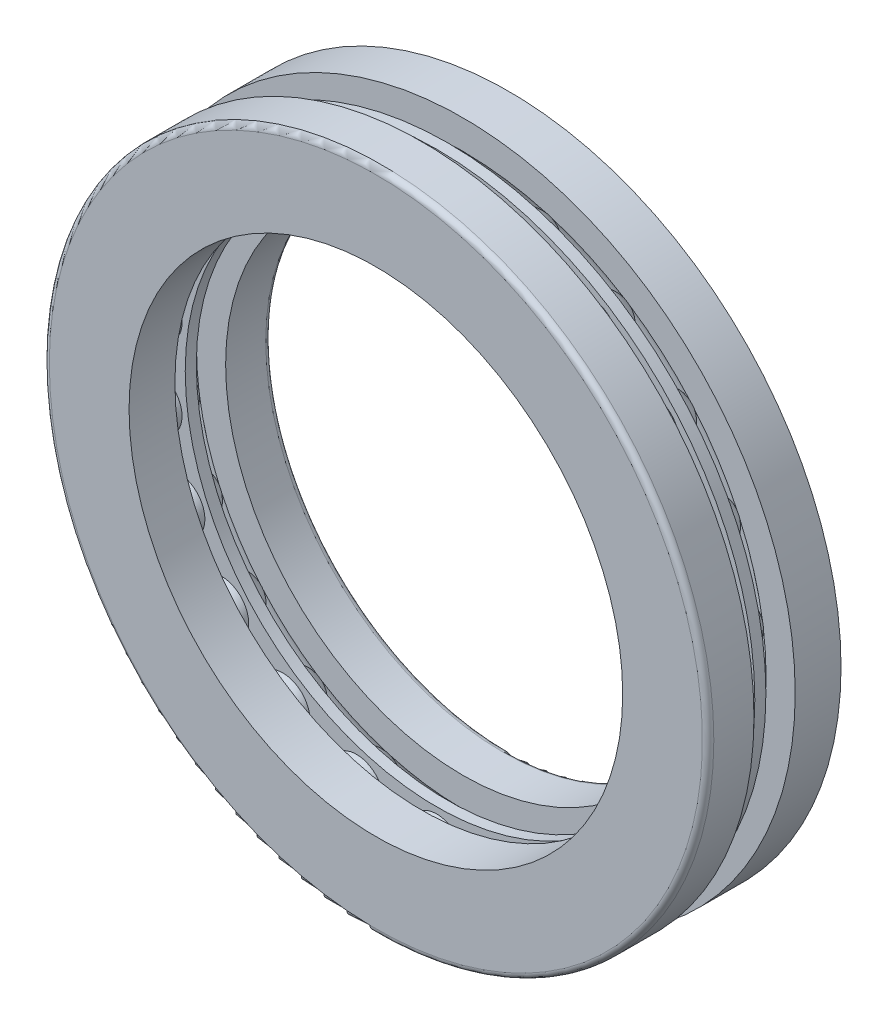
from build123d import *
from build123d.topology import SkipClean

# Parameters (mm, degrees)
FILLET1_R            = 0.6
CIRPATTERNBALL_COUNT = 22
CAGESKE_W            = 1.166666666
CAGESKE_H            = 7


with BuildPart() as part:
    # BaseSke → Ball (revolve)
    with BuildSketch(Plane(origin=(0, 0, 0), x_dir=(0, 0, -1), z_dir=(1, 0, 0))):
        with BuildLine():
            Line((0, 32.916666667), (0, 27.083333333))
            ThreePointArc((0, 27.083333333), (-2.916666667, 30), (0, 32.916666667))
        make_face()
    ball = revolve(axis=Axis((0, 32.916666667, 0), (0, -1, 0)))

    # InnerRaceSke → InnerRace (revolve)
    with BuildSketch(Plane(origin=(0, 0, 0), x_dir=(0, 0, -1), z_dir=(1, 0, 0))):
        with BuildLine():
            Line((2.172413793, 28.068852822), (2.172413793, 25))
            Line((2.172413793, 25), (7, 25))
            Line((7, 25), (7, 35))
            Line((7, 35), (2.172413793, 35))
            Line((2.172413793, 35), (2.172413793, 31.931147178))
            ThreePointArc((2.172413793, 31.931147178), (2.906666667, 30), (2.172413793, 28.068852822))
        make_face()
    revolve(axis=Axis((0, 0, 18.95903793), (0, 0, -1)))

    # OuterRaceSke → OuterRace (revolve)
    with BuildSketch(Plane(origin=(0, 0, 0), x_dir=(0, 0, -1), z_dir=(1, 0, 0))):
        with BuildLine():
            Line((-2.172413793, 28.068852822), (-2.172413793, 26))
            Line((-2.172413793, 26), (-7, 26))
            Line((-7, 26), (-7, 35))
            Line((-7, 35), (-2.172413793, 35))
            Line((-2.172413793, 35), (-2.172413793, 31.931147178))
            ThreePointArc((-2.172413793, 31.931147178), (-2.906666667, 30), (-2.172413793, 28.068852822))
        make_face()
    revolve(axis=Axis((0, 0, 27.164343587), (0, 0, -1)))

    # Fillet1
    fillet1_edges = [part.edges().sort_by_distance(p)[0] for p in [
        (0, -35, 7),
        (0, -25, -7),
    ]]
    fillet(fillet1_edges, radius=FILLET1_R)

    # CirPatternBall: Ball ×22 about axis
    cirpatternball_axis = Axis((0, 0, 27.164343587), (0, 0, -1))
    for i in range(1, CIRPATTERNBALL_COUNT):
        add(ball.rotate(cirpatternball_axis, i * 360 / CIRPATTERNBALL_COUNT))

    # CageSke → Cage (revolve)
    with SkipClean():  # the faces are left unmerged after this step: merging them gives an invalid solid
        with BuildSketch(Plane(origin=(0, 0, 0), x_dir=(0, 0, -1), z_dir=(1, 0, 0))):
            with Locations((0, 30)):
                Rectangle(CAGESKE_W, CAGESKE_H)
        revolve(axis=Axis((0, 0, 23.077030378), (0, 0, -1)))


solid = part.part
